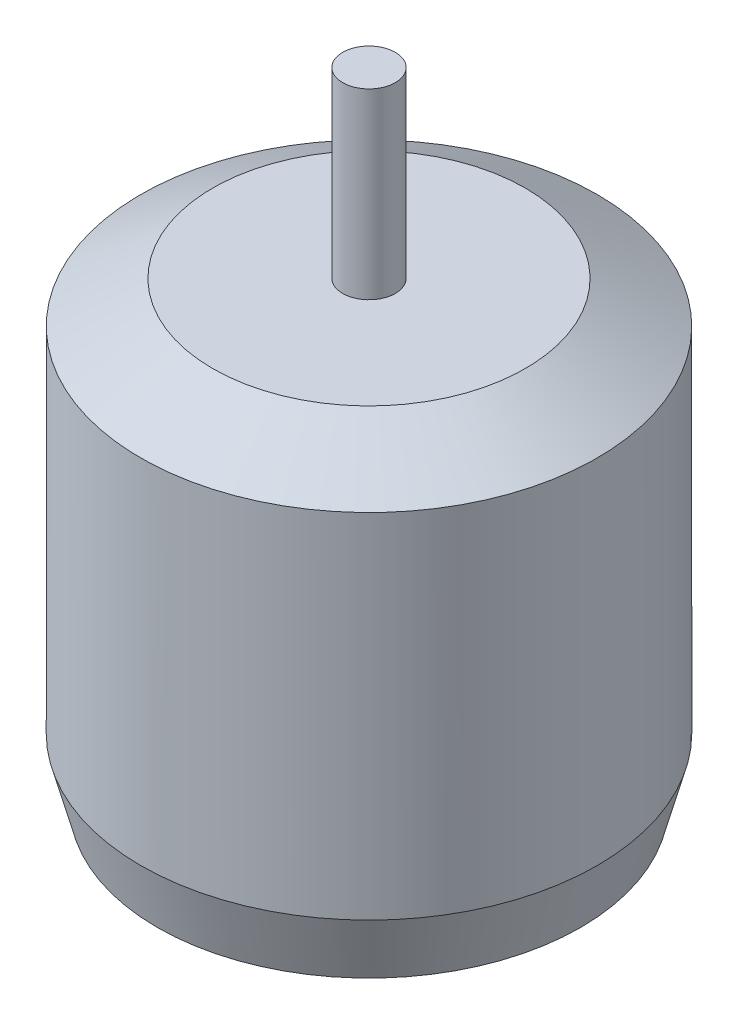
from build123d import *

# Parameters (mm, degrees)
SKETCH1_R           = 13.75
BOSS_EXTRUDE1_DEPTH = 27.5
SKETCH3_R           = 1.585
BOSS_EXTRUDE2_DEPTH = 11
CHAMFER1_SIZE       = 2.5
CHAMFER1_SIZE2      = 4.330127019
CHAMFER2_SIZE       = 1
CHAMFER2_SIZE2      = 3.732050808
CIRPATTERN1_COUNT   = 4


with BuildPart() as part:
    # Sketch1 → Boss-Extrude1 (new body)
    with BuildSketch(Plane(origin=(0, 0, 0), x_dir=(1, 0, 0), z_dir=(0, 1, 0))):
        Circle(SKETCH1_R)
    extrude(amount=BOSS_EXTRUDE1_DEPTH)

    # Sketch3 → Boss-Extrude2 (add)
    with BuildSketch(Plane(origin=(0, 27.5, 0), x_dir=(1, 0, 0), z_dir=(0, 1, 0))):
        Circle(SKETCH3_R)
    extrude(amount=BOSS_EXTRUDE2_DEPTH)

    # Chamfer1
    chamfer1_edges = [part.edges().sort_by_distance(p)[0] for p in [
        (-13.75, 27.5, 0),
    ]]
    chamfer1_side = [part.faces().sort_by_distance(p)[0] for p in [
        (-13.75, 13.75, 0),
    ]]
    chamfer(chamfer1_edges, length=CHAMFER1_SIZE, length2=CHAMFER1_SIZE2, reference=chamfer1_side[0])

    # Chamfer2
    chamfer2_edges = [part.edges().sort_by_distance(p)[0] for p in [
        (-13.75, 0, 0),
    ]]
    chamfer2_side = [part.faces().sort_by_distance(p)[0] for p in [
        (0, 0, 0),
    ]]
    chamfer(chamfer2_edges, length=CHAMFER2_SIZE, length2=CHAMFER2_SIZE2, reference=chamfer2_side[0])

    # Sketch5 → Ø3.0mm Dowel Hole1 (revolve, cut)
    with BuildSketch(Plane(origin=(0, 0, 10), x_dir=(0, 0, -1), z_dir=(1, 0, 0))):
        Polygon((0, 0), (0, 3.901290929), (1.5, 3), (1.5, 0), align=None)
    f_3_0mm_dowel_hole1 = revolve(axis=Axis((0, -6.35, 10), (0, 1, 0)), mode=Mode.SUBTRACT)

    # CirPattern1: Ø3.0mm Dowel Hole1 ×4 about axis
    cirpattern1_axis = Axis((0, 0, 0), (0, -1, 0))
    for i in range(1, CIRPATTERN1_COUNT):
        add(f_3_0mm_dowel_hole1.rotate(cirpattern1_axis, i * 360 / CIRPATTERN1_COUNT), mode=Mode.SUBTRACT)


solid = part.part
